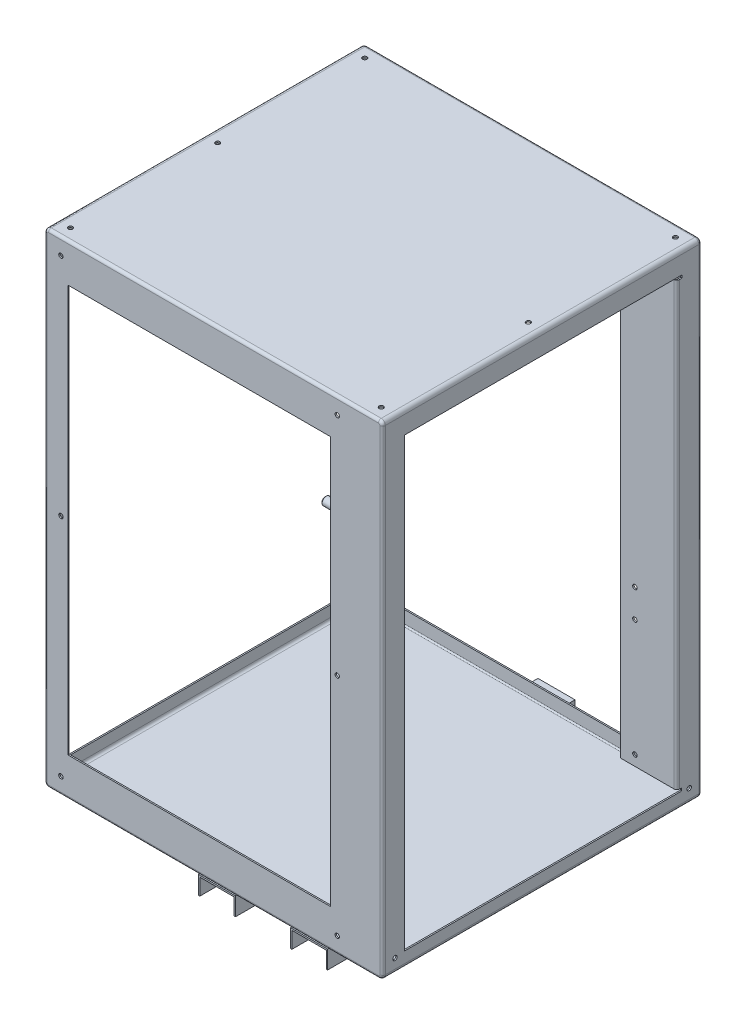
from build123d import *

# Parameters (mm, degrees)
EXTRUDE_1_DEPTH             = 232
SKETCH_2_W                  = 200
SKETCH_2_H                  = 325
CUT_EXTRUDE_1_DEPTH         = 500
EXTRUDE_START               = -1
EXTRUDE_1_2_DEPTH           = 1
SKETCH_4_W                  = 214
SKETCH_4_H                  = 325
EXTRUDE_2_DEPTH             = 1
FILLET_1_R                  = 1
FILLET_2_R                  = 2
SKETCH_6_R                  = 3
EXTRUDE_3_DEPTH             = 20
CHAMFER_1_SIZE              = 1
SKETCH_7_R                  = 1.6
CUT_EXTRUDE_3_DEPTH         = 20
SKETCH_8_W                  = 191
SKETCH_8_H                  = 296
CUT_EXTRUDE_4_DEPTH         = 2
SKETCH_9_R                  = 1.6
CUT_EXTRUDE_5_DEPTH         = 2
EXTRUDE_6_REACH             = 396.406
EXTRUDE_6_DIRECTION_2_DEPTH = 15
SKETCH_16_W                 = 1
SKETCH_16_H                 = 325
EXTRUDE_9_DEPTH             = 2
SKETCH_17_W                 = 1
SKETCH_17_H                 = 321
EXTRUDE_10_DEPTH            = 40
SKETCH_18_W                 = 1
SKETCH_18_H                 = 321
EXTRUDE_11_DEPTH            = 40
SKETCH_19_W                 = 3.5
SKETCH_19_H                 = 2
CUT_EXTRUDE_8_DEPTH         = 40
SKETCH_20_R                 = 1.6
CUT_EXTRUDE_9_DEPTH         = 10
FILLET_4_R                  = 2
SKETCH_22_W                 = 4.75100146
SKETCH_22_H                 = 2.010828375
SKETCH_22_W_2               = 3.5
SKETCH_22_H_2               = 2
CUT_EXTRUDE_11_DEPTH        = 10
SKETCH_23_R                 = 1.6
CUT_EXTRUDE_12_DEPTH        = 10
SKETCH_24_R                 = 1.6
CUT_EXTRUDE_13_DEPTH        = 10


with BuildPart() as part:
    # Эскиз1 → Extrude 1 (new body)
    with BuildSketch(Plane.XY):
        with BuildLine():
            Line((123, -173), (123, 173))
            ThreePointArc((123, 173), (122.121320344, 175.121320344), (120, 176))
            Line((120, 176), (-120, 176))
            ThreePointArc((-120, 176), (-122.121320344, 175.121320344), (-123, 173))
            Line((-123, 173), (-123, -173))
            ThreePointArc((-123, -173), (-122.121320344, -175.121320344), (-120, -176))
            Line((-120, -176), (120, -176))
            ThreePointArc((120, -176), (122.121320344, -175.121320344), (123, -173))
        make_face()
        with BuildLine():
            Line((122, -173), (122, 173))
            ThreePointArc((122, 173), (121.414213562, 174.414213562), (120, 175))
            Line((120, 175), (-120, 175))
            ThreePointArc((-120, 175), (-121.414213562, 174.414213562), (-122, 173))
            Line((-122, 173), (-122, -173))
            ThreePointArc((-122, -173), (-121.414213562, -174.414213562), (-120, -175))
            Line((-120, -175), (120, -175))
            ThreePointArc((120, -175), (121.414213562, -174.414213562), (122, -173))
        make_face(mode=Mode.SUBTRACT)
    extrude(amount=EXTRUDE_1_DEPTH)

    # Эскиз2 → Вырез-Вытянуть1 (cut)
    with BuildSketch(Plane(origin=(123, 0, 0), x_dir=(0, 0, -1), z_dir=(1, 0, 0))):
        with Locations((-116, -2.5)):
            Rectangle(SKETCH_2_W, SKETCH_2_H)
    extrude(amount=-CUT_EXTRUDE_1_DEPTH, mode=Mode.SUBTRACT)

    # Эскиз3 → Extrude 1 2 (add)
    with BuildSketch(Plane.XY.offset(232).offset(EXTRUDE_START)):
        with BuildLine():
            Line((-123, 173), (-123, -173))
            ThreePointArc((-123, -173), (-122.121320344, -175.121320344), (-120, -176))
            Line((-120, -176), (120, -176))
            ThreePointArc((120, -176), (122.121320344, -175.121320344), (123, -173))
            Line((123, -173), (123, 173))
            ThreePointArc((123, 173), (122.121320344, 175.121320344), (120, 176))
            Line((120, 176), (-120, 176))
            ThreePointArc((-120, 176), (-122.121320344, 175.121320344), (-123, 173))
        make_face()
    extrude(amount=EXTRUDE_1_2_DEPTH)

    # Эскиз4 → Вытянуть2 (add)
    with BuildSketch(Plane(origin=(0, 0, 0), x_dir=(-1, 0, 0), z_dir=(0, 0, -1))):
        with BuildLine():
            Line((120, 176), (-120, 176))
            ThreePointArc((-120, 176), (-122.121320344, 175.121320344), (-123, 173))
            Line((-123, 173), (-123, -173))
            ThreePointArc((-123, -173), (-122.121320344, -175.121320344), (-120, -176))
            Line((-120, -176), (120, -176))
            ThreePointArc((120, -176), (122.121320344, -175.121320344), (123, -173))
            Line((123, -173), (123, 173))
            ThreePointArc((123, 173), (122.121320344, 175.121320344), (120, 176))
        make_face()
        with Locations((0, -2.5)):
            Rectangle(SKETCH_4_W, SKETCH_4_H, mode=Mode.SUBTRACT)
    extrude(amount=-EXTRUDE_2_DEPTH)

    # Скругление1
    fillet_1_edges = [part.edges().sort_by_distance(p)[0] for p in [
        (-122, 0, 1),
        (-121.414213562, 174.414213562, 1),
        (0, 175, 1),
        (121.414213562, 174.414213562, 1),
        (122, 0, 1),
        (121.414213562, -174.414213562, 1),
        (0, -175, 1),
        (-121.414213562, -174.414213562, 1),
        (0, 175, 231),
        (-121.414213562, 174.414213562, 231),
        (-122, 0, 231),
        (-121.414213562, -174.414213562, 231),
        (0, -175, 231),
        (121.414213562, -174.414213562, 231),
        (122, 0, 231),
        (121.414213562, 174.414213562, 231),
    ]]
    fillet(fillet_1_edges, radius=FILLET_1_R)

    # Скругление2
    fillet_2_edges = [part.edges().sort_by_distance(p)[0] for p in [
        (-122.121320344, -175.121320344, 232),
        (0, -176, 232),
        (122.121320344, -175.121320344, 232),
        (123, 0, 232),
        (122.121320344, 175.121320344, 232),
        (0, 176, 232),
        (-122.121320344, 175.121320344, 232),
        (0, 176, 0),
        (122.121320344, 175.121320344, 0),
        (123, 0, 0),
        (122.121320344, -175.121320344, 0),
        (0, -176, 0),
        (-122.121320344, -175.121320344, 0),
        (-123, 0, 0),
        (-122.121320344, 175.121320344, 0),
        (-123, 0, 232),
    ]]
    fillet(fillet_2_edges, radius=FILLET_2_R)

    # Эскиз6 → Вытянуть3 (add)
    with BuildSketch(Plane.ZY.offset(123)):
        with Locations(Location((8, -118, 0), (0, 0, 180))):
            Circle(SKETCH_6_R)
    extrude(amount=EXTRUDE_3_DEPTH)

    # Фаска1
    chamfer_1_edges = [part.edges().sort_by_distance(p)[0] for p in [
        (-143, -118, 11),
    ]]
    chamfer(chamfer_1_edges, length=CHAMFER_1_SIZE)

    # Эскиз7 → Вырез-Вытянуть3 (cut)
    with BuildSketch(Plane.ZY.offset(123)):
        with Locations((9, -95)):
            Circle(SKETCH_7_R)
        with Locations((9, -159)):
            Circle(SKETCH_7_R)
        with Locations(Location((223, -95, 0), (0, 0, 180))):
            Circle(SKETCH_7_R)
        with Locations(Location((223, -159, 0), (0, 0, 180))):
            Circle(SKETCH_7_R)
        with Locations((9, -80)):
            Circle(SKETCH_7_R)
        with Locations(Location((223, -80, 0), (0, 0, 180))):
            Circle(SKETCH_7_R)
        with Locations((9, 168)):
            Circle(SKETCH_7_R)
        with Locations(Location((223, 168, 0), (0, 0, 180))):
            Circle(SKETCH_7_R)
    extrude(amount=-CUT_EXTRUDE_3_DEPTH, mode=Mode.SUBTRACT)

    # Эскиз8 → Вырез-Вытянуть4 (cut)
    with BuildSketch(Plane.XY.offset(232)):
        with Locations((-10.5, 0)):
            Rectangle(SKETCH_8_W, SKETCH_8_H)
    extrude(amount=-CUT_EXTRUDE_4_DEPTH, mode=Mode.SUBTRACT)

    # Эскиз9 → Вырез-Вытянуть5 (cut)
    with BuildSketch(Plane.XY.offset(232)):
        with Locations((-111, 164)):
            Circle(SKETCH_9_R)
        with Locations((-111, 0)):
            Circle(SKETCH_9_R)
        with Locations((-111, -164)):
            Circle(SKETCH_9_R)
        with Locations((90, -164)):
            Circle(SKETCH_9_R)
        with Locations((90, 0)):
            Circle(SKETCH_9_R)
        with Locations((90, 164)):
            Circle(SKETCH_9_R)
    extrude(amount=-CUT_EXTRUDE_5_DEPTH, mode=Mode.SUBTRACT)

    # Вытянуть6: up to this face of the body (flat: up to its plane)
    extrude_6_end = Plane(part.part.faces().sort_by_distance((-117.709874725, -170.709874725, 232))[0])
    # Эскиз10 → Вытянуть6 (add, up to the picked face)
    with BuildSketch(Plane(origin=(123, 0, 0), x_dir=(1, 0, 0), z_dir=(0, 0, 1)), mode=Mode.PRIVATE) as extrude_6_sk1:
        Polygon((-134, -176.015230639), (-134, -175.815230639), (-107, -175.815230639), (-107, -176.015230639), (-107, -189.015230639), (-108, -189.015230639), (-108, -177.015230639), (-133, -177.015230639), (-133, -189.015230639), (-134, -189.015230639), align=None)
    extrude_6_tool1 = split(extrude(extrude_6_sk1.sketch, amount=EXTRUDE_6_REACH, mode=Mode.PRIVATE), bisect_by=extrude_6_end, keep=Keep.BOTH, mode=Mode.PRIVATE)
    # Эскиз10 → Вытянуть6 (add, up to the picked face)
    with BuildSketch(Plane(origin=(123, 0, 0), x_dir=(1, 0, 0), z_dir=(0, 0, 1)), mode=Mode.PRIVATE) as extrude_6_sk2:
        Polygon((-67, -176.015230639), (-67, -175.815230639), (-40, -175.815230639), (-40, -176.015230639), (-40, -189.015230639), (-41, -189.015230639), (-41, -177.015230639), (-66, -177.015230639), (-66, -189.015230639), (-67, -189.015230639), align=None)
    extrude_6_tool2 = split(extrude(extrude_6_sk2.sketch, amount=EXTRUDE_6_REACH, mode=Mode.PRIVATE), bisect_by=extrude_6_end, keep=Keep.BOTH, mode=Mode.PRIVATE)
    add(extrude_6_tool1.solids().sort_by(Axis((-10.69946, -175.915231, 0), (0, 0, 1)))[0])
    add(extrude_6_tool2.solids().sort_by(Axis((56.30054, -175.915231, 0), (0, 0, 1)))[0])

    # Эскиз10 → Вытянуть6 direction 2 (add)
    with BuildSketch(Plane(origin=(123, 0, 0), x_dir=(1, 0, 0), z_dir=(0, 0, 1))):
        Polygon((-134, -176.015230639), (-134, -175.815230639), (-107, -175.815230639), (-107, -176.015230639), (-107, -189.015230639), (-108, -189.015230639), (-108, -177.015230639), (-133, -177.015230639), (-133, -189.015230639), (-134, -189.015230639), align=None)
        Polygon((-67, -176.015230639), (-67, -175.815230639), (-40, -175.815230639), (-40, -176.015230639), (-40, -189.015230639), (-41, -189.015230639), (-41, -177.015230639), (-66, -177.015230639), (-66, -189.015230639), (-67, -189.015230639), align=None)
    extrude(amount=-EXTRUDE_6_DIRECTION_2_DEPTH)

    # Эскиз16 → Вытянуть9 (add)
    with BuildSketch(Plane.XY.offset(16)):
        with Locations((122.5, -2.5)):
            Rectangle(SKETCH_16_W, SKETCH_16_H)
        with Locations((-122.5, -2.5)):
            Rectangle(SKETCH_16_W, SKETCH_16_H)
    extrude(amount=EXTRUDE_9_DEPTH)

    # Эскиз17 → Вытянуть10 (add)
    with BuildSketch(Plane.ZY.offset(-122)):
        with Locations((17.5, -2.5)):
            Rectangle(SKETCH_17_W, SKETCH_17_H)
    extrude(amount=EXTRUDE_10_DEPTH)

    # Эскиз18 → Вытянуть11 (add)
    with BuildSketch(Plane(origin=(-122, 0, 0), x_dir=(0, 0, -1), z_dir=(1, 0, 0))):
        with Locations((-17.5, -2.5)):
            Rectangle(SKETCH_18_W, SKETCH_18_H)
    extrude(amount=EXTRUDE_11_DEPTH)

    # Эскиз19 → Вырез-Вытянуть8 (cut)
    with BuildSketch(Plane(origin=(-122, 0, 0), x_dir=(0, 0, -1), z_dir=(1, 0, 0))):
        with Locations((-16.25, -164)):
            Rectangle(SKETCH_19_W, SKETCH_19_H)
        with Locations((-16.25, 159)):
            Rectangle(SKETCH_19_W, SKETCH_19_H)
    extrude(amount=-CUT_EXTRUDE_8_DEPTH, mode=Mode.SUBTRACT)

    # Эскиз20 → Вырез-Вытянуть9 (cut)
    with BuildSketch(Plane(origin=(0, 0, 17), x_dir=(-1, 0, 0), z_dir=(0, 0, -1))):
        with Locations((-92.5, 145.5)):
            Circle(SKETCH_20_R)
        with Locations((-92.5, -50)):
            Circle(SKETCH_20_R)
        with Locations((-92.5, -155.5)):
            Circle(SKETCH_20_R)
        with Locations(Location((92.5, -155.5, 0), (0, 0, 180))):
            Circle(SKETCH_20_R)
        with Locations(Location((92.5, -50, 0), (0, 0, 180))):
            Circle(SKETCH_20_R)
        with Locations(Location((92.5, 145.5, 0), (0, 0, 180))):
            Circle(SKETCH_20_R)
        with Locations((-92.5, -70.5)):
            Circle(SKETCH_20_R)
        with Locations(Location((92.5, -70.5, 0), (0, 0, 180))):
            Circle(SKETCH_20_R)
    extrude(amount=-CUT_EXTRUDE_9_DEPTH, mode=Mode.SUBTRACT)

    # Скругление4
    # the kernel refuses this fillet: 2 mm, written as the material it takes off along each edge
    with BuildSketch(Plane(origin=(123, -165, 18), x_dir=(0, 0, -1), z_dir=(0, 1, 0))) as fillet_4_piece_1:
        with BuildLine():
            CenterArc((FILLET_4_R, FILLET_4_R), FILLET_4_R, 180, 90)
            Line((0, FILLET_4_R), (0, 0))
            Line((0, 0), (FILLET_4_R, 0))
        make_face()
    extrude(amount=325, mode=Mode.SUBTRACT)
    with BuildSketch(Plane(origin=(-123, 158, 18), x_dir=(0, 0, -1), z_dir=(0, -1, 0))) as fillet_4_piece_2_section:
        with BuildLine():
            CenterArc((FILLET_4_R, FILLET_4_R), FILLET_4_R, 180, 90)
            Line((0, FILLET_4_R), (0, 0))
            Line((0, 0), (FILLET_4_R, 0))
        make_face()
    fillet_4_piece_2 = extrude(amount=326, mode=Mode.PRIVATE)
    fillet_4_piece_2 = split(fillet_4_piece_2, bisect_by=Plane(origin=(-122.64320814, -165, 17.511950301), z_dir=(0, 1, 0)), keep=Keep.TOP, mode=Mode.PRIVATE)
    add(fillet_4_piece_2, mode=Mode.SUBTRACT)
    with BuildSketch(Plane(origin=(-122, 160, 216), x_dir=(-1, 0, 0), z_dir=(0, -1, 0))) as fillet_4_piece_3:
        with BuildLine():
            CenterArc((2, -1.732050808), FILLET_4_R, 120, 60)
            Line((0, -1.732050808), (0, 0))
            Line((0, 0), (1, 0))
        make_face()
    extrude(amount=325, mode=Mode.SUBTRACT)

    # Эскиз22 → Вырез-Вытянуть11 (cut)
    with BuildSketch(Plane.ZY.offset(-122)):
        with Locations((16.87550073, -163.994585813)):
            Rectangle(SKETCH_22_W, SKETCH_22_H)
        with Locations((15.982050808, 159)):
            Rectangle(SKETCH_22_W_2, SKETCH_22_H_2)
    extrude(amount=-CUT_EXTRUDE_11_DEPTH, mode=Mode.SUBTRACT)

    # Эскиз23 → Вырез-Вытянуть12 (cut)
    with BuildSketch(Plane(origin=(0, 176, 0), x_dir=(1, 0, 0), z_dir=(0, 1, 0))):
        with Locations(Location((-113, -223, 0), (0, 0, 270))):
            Circle(SKETCH_23_R)
        with Locations(Location((-113, -116, 0), (0, 0, 270))):
            Circle(SKETCH_23_R)
        with Locations(Location((-113, -9, 0), (0, 0, 270))):
            Circle(SKETCH_23_R)
        with Locations(Location((113, -223, 0), (0, 0, 90))):
            Circle(SKETCH_23_R)
        with Locations(Location((113, -116, 0), (0, 0, 90))):
            Circle(SKETCH_23_R)
        with Locations(Location((113, -9, 0), (0, 0, 90))):
            Circle(SKETCH_23_R)
    extrude(amount=-CUT_EXTRUDE_12_DEPTH, mode=Mode.SUBTRACT)

    # Эскиз24 → Вырез-Вытянуть13 (cut)
    with BuildSketch(Plane(origin=(123, 0, 0), x_dir=(0, 0, -1), z_dir=(1, 0, 0))):
        with Locations((-9, -166)):
            Circle(SKETCH_24_R)
        with Locations((-223, -166)):
            Circle(SKETCH_24_R)
    extrude(amount=-CUT_EXTRUDE_13_DEPTH, mode=Mode.SUBTRACT)


solid = part.part
